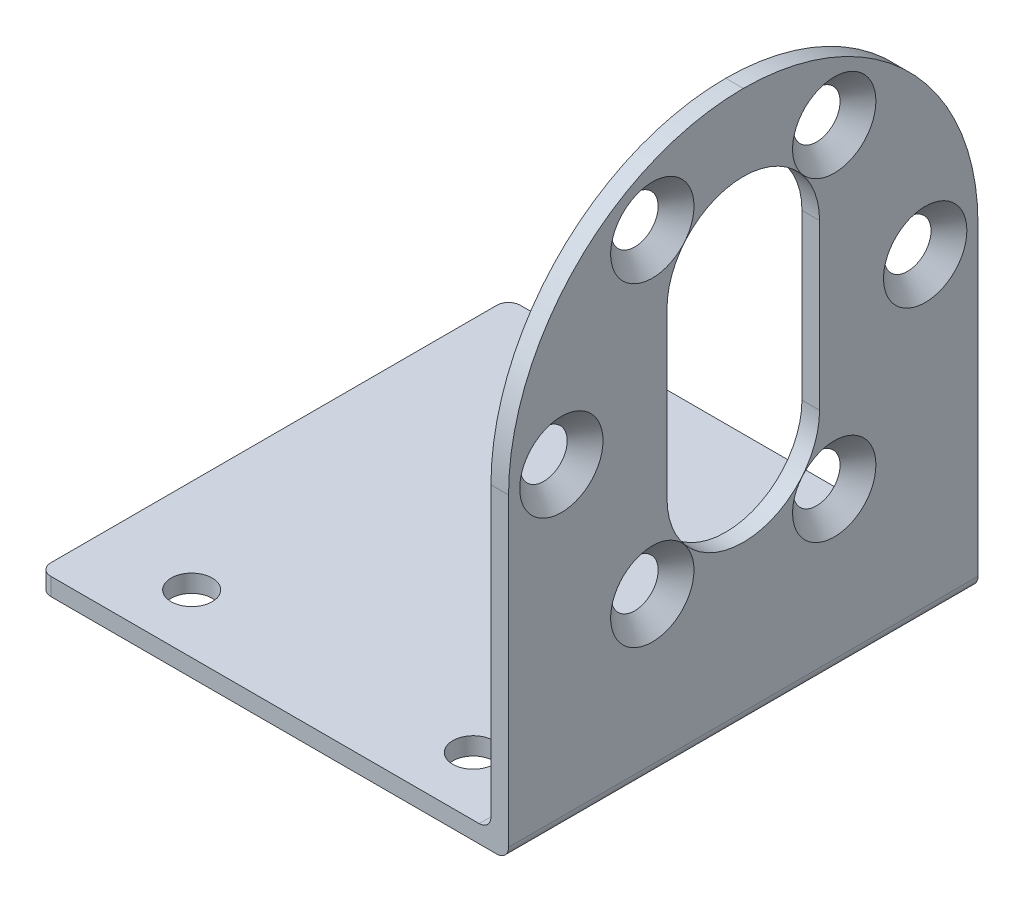
from build123d import *

# Parameters (mm, degrees)
SKETCH_1_W                   = 40
SKETCH_1_H                   = 40
EXTRUDE_1_DEPTH              = 1.5
SKETCH_2_R                   = 1.75
CUT_EXTRUDE_1_DEPTH          = 29.324018077
EXTRUDE_START                = -1.5
SKETCH_3_W                   = 1.5
SKETCH_3_H                   = 40
EXTRUDE_2_DEPTH              = 47
SKETCH_4_R                   = 1.5
CUT_EXTRUDE_2_DEPTH          = 65.876806333
HOLE_WIZARD_M3_1_D           = 3.4
HOLE_WIZARD_M3_1_DEPTH       = 15
HOLE_WIZARD_M3_1_CSINK_D     = 7.1
HOLE_WIZARD_M3_1_CSINK_ANGLE = 92
HOLE_WIZARD_M3_1_TIP         = 1.021463052
FILLET_1_R                   = 20
FILLET_2_R                   = 1


with BuildPart() as part:
    # 스케치1 → 보스-돌출1 (new body)
    with BuildSketch(Plane(origin=(0, 0, 0), x_dir=(1, 0, 0), z_dir=(0, 1, 0))):
        Rectangle(SKETCH_1_W, SKETCH_1_H)
    extrude(amount=EXTRUDE_1_DEPTH)

    # 스케치2 → 컷-돌출1 (cut, through all)
    with BuildSketch(Plane(origin=(0, 1.5, 0), x_dir=(1, 0, 0), z_dir=(0, 1, 0))):
        with Locations(Location((-12, 15, 0), (0, 0, 270))):
            Circle(SKETCH_2_R)
        with Locations(Location((12, 15, 0), (0, 0, 270))):
            Circle(SKETCH_2_R)
        with Locations(Location((-12, -15, 0), (0, 0, 270))):
            Circle(SKETCH_2_R)
        with Locations(Location((12, -15, 0), (0, 0, 270))):
            Circle(SKETCH_2_R)
    extrude(amount=-CUT_EXTRUDE_1_DEPTH, mode=Mode.SUBTRACT)

    # 스케치3 → 보스-돌출2 (add)
    with BuildSketch(Plane(origin=(0, 1.5, 0), x_dir=(1, 0, 0), z_dir=(0, 1, 0)).offset(EXTRUDE_START)):
        with Locations((19.25, 0)):
            Rectangle(SKETCH_3_W, SKETCH_3_H)
    extrude(amount=EXTRUDE_2_DEPTH)

    # 스케치4 → 컷-돌출2 (cut, through all)
    with BuildSketch(Plane(origin=(20, 0, 0), x_dir=(0, 0, -1), z_dir=(1, 0, 0))):
        with Locations((15.5, 27)):
            Circle(SKETCH_4_R)
        with Locations((7.75, 13.576606241)):
            Circle(SKETCH_4_R)
        with Locations((-7.75, 13.576606241)):
            Circle(SKETCH_4_R)
        with Locations((-15.5, 27)):
            Circle(SKETCH_4_R)
        with Locations((-7.75, 40.423393759)):
            Circle(SKETCH_4_R)
        with Locations((7.75, 40.423393759)):
            Circle(SKETCH_4_R)
        with BuildLine():
            Line((-6.5, 20), (-6.5, 34))
            ThreePointArc((-6.5, 34), (0, 40.5), (6.5, 34))
            Line((6.5, 34), (6.5, 20))
            ThreePointArc((6.5, 20), (0, 13.5), (-6.5, 20))
        make_face()
    extrude(amount=-CUT_EXTRUDE_2_DEPTH, mode=Mode.SUBTRACT)

    # M3 둥근 십자머리 나사용 카운터싱크1
    with Locations(Plane(origin=(20, 0, 0), x_dir=(0, 0, -1), z_dir=(1, 0, 0))):
        with Locations((15.5, 27), (7.75, 40.423393759), (-7.75, 40.423393759), (-15.5, 27), (-7.75, 13.576606241), (7.75, 13.576606241)):
            CounterSinkHole(HOLE_WIZARD_M3_1_D / 2, HOLE_WIZARD_M3_1_CSINK_D / 2, depth=HOLE_WIZARD_M3_1_DEPTH, counter_sink_angle=HOLE_WIZARD_M3_1_CSINK_ANGLE)
            with Locations((0, 0, -(HOLE_WIZARD_M3_1_DEPTH + HOLE_WIZARD_M3_1_TIP / 2))):  # 118° drill point
                Cone(0, HOLE_WIZARD_M3_1_D / 2, HOLE_WIZARD_M3_1_TIP, mode=Mode.SUBTRACT)

    # 필렛1
    fillet_1_edges = [part.edges().sort_by_distance(p)[0] for p in [
        (19.25, 47, -20),
        (19.25, 47, 20),
    ]]
    fillet(fillet_1_edges, radius=FILLET_1_R - 0.0001)  # a hair under: the kernel refuses the full size

    # 필렛2
    fillet_2_edges = [part.edges().sort_by_distance(p)[0] for p in [
        (18.5, 1.5, 0),
        (20, 0, 0),
        (-20, 0.75, 20),
        (-20, 0.75, -20),
    ]]
    fillet(fillet_2_edges, radius=FILLET_2_R)


solid = part.part
